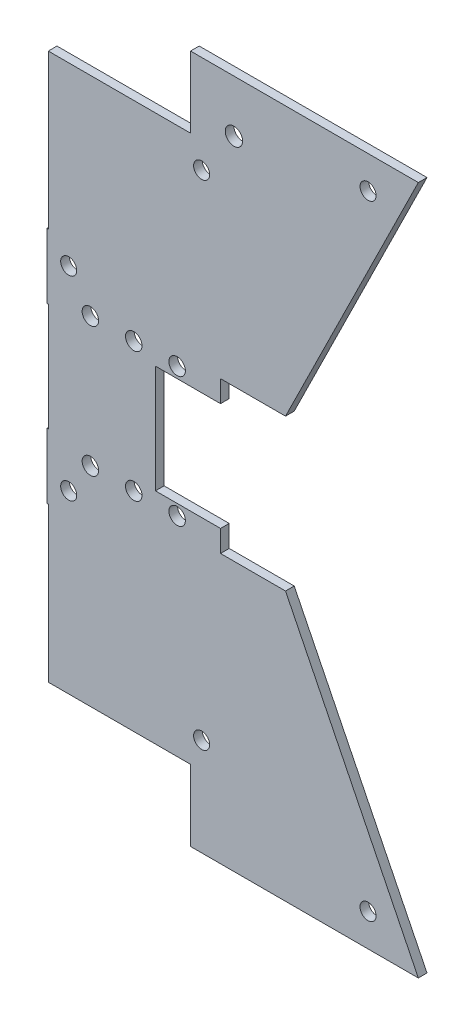
from build123d import *

# Parameters (mm, degrees)
SKETCH1_R           = 2.3495
SKETCH1_R_2         = 2.54
BOSS_EXTRUDE1_DEPTH = 2.54
SKETCH2_R           = 2.413
CUT_EXTRUDE1_DEPTH  = 217.884748371
SKETCH3_W           = 19.05
SKETCH3_H           = 31.623
CUT_EXTRUDE2_DEPTH  = 217.884748371


with BuildPart() as part:
    # Sketch1 → Boss-Extrude1 (new body)
    with BuildSketch(Plane.XY):
        Polygon((-2.930050059, -104.509781075), (-3.314938219, -104.509781075), (-3.314938219, -110.859781075), (-3.314938219, -123.559781075), (-2.930050059, -123.559781075), (-2.930050059, -168.708281075), (38.709428475, -168.708281075), (38.709428475, -189.536281075), (105.397061781, -189.536281075), (66.517436481, -110.859781075), (47.485061781, -110.859781075), (47.485061781, -104.509781075), (47.485061781, -72.886781075), (47.485061781, -66.536781075), (66.517436481, -66.536781075), (105.397061781, 12.139718925), (38.709428475, 12.139718925), (38.709428475, -8.688281075), (-2.930050059, -8.688281075), (-2.930050059, -53.836781075), (-3.314938219, -53.836781075), (-3.314938219, -66.536781075), (-3.314938219, -72.886781075), (-2.930050059, -72.886781075), align=None)
        with Locations((90.673911143, 2.614718925)):
            Circle(SKETCH1_R, mode=Mode.SUBTRACT)
        with Locations((41.95655448, -16.435281075)):
            Circle(SKETCH1_R, mode=Mode.SUBTRACT)
        with Locations((3.035061781, -60.186781075)):
            Circle(SKETCH1_R, mode=Mode.SUBTRACT)
        with Locations((3.035061781, -117.209781075)):
            Circle(SKETCH1_R, mode=Mode.SUBTRACT)
        with Locations((41.95655448, -160.961281075)):
            Circle(SKETCH1_R, mode=Mode.SUBTRACT)
        with Locations((90.673911143, -180.011281075)):
            Circle(SKETCH1_R, mode=Mode.SUBTRACT)
        with Locations((51.409428475, -3.100281075)):
            Circle(SKETCH1_R_2, mode=Mode.SUBTRACT)
    extrude(amount=BOSS_EXTRUDE1_DEPTH)

    # Sketch2 → Cut-Extrude1 (cut, through all)
    with BuildSketch(Plane.XY.offset(2.54)):
        with Locations((9.385061781, -69.711781075)):
            Circle(SKETCH2_R)
        with Locations((22.085061781, -69.711781075)):
            Circle(SKETCH2_R)
        with Locations((34.785061781, -69.711781075)):
            Circle(SKETCH2_R)
        with Locations((34.785061781, -107.684781075)):
            Circle(SKETCH2_R)
        with Locations((22.085061781, -107.684781075)):
            Circle(SKETCH2_R)
        with Locations((9.385061781, -107.684781075)):
            Circle(SKETCH2_R)
    extrude(amount=-CUT_EXTRUDE1_DEPTH, mode=Mode.SUBTRACT)

    # Sketch3 → Cut-Extrude2 (cut, through all)
    with BuildSketch(Plane.XY.offset(2.54)):
        with Locations((37.960061781, -88.698281075)):
            Rectangle(SKETCH3_W, SKETCH3_H)
    extrude(amount=-CUT_EXTRUDE2_DEPTH, mode=Mode.SUBTRACT)


solid = part.part
